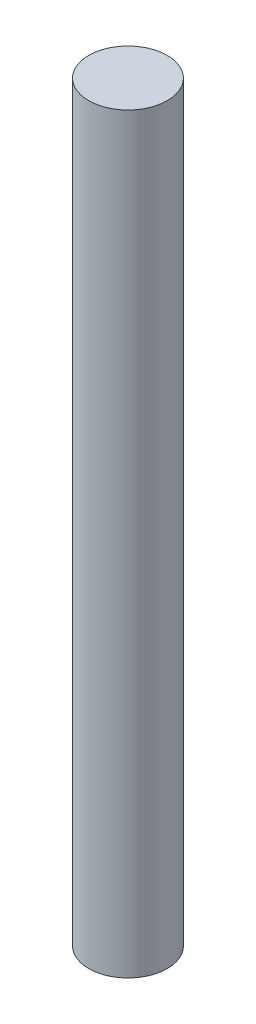
from build123d import *

# Parameters (mm, degrees)
SKETCH1_R           = 2.609499656
BOSS_EXTRUDE1_DEPTH = 50


with BuildPart() as part:
    # Sketch1 → Boss-Extrude1 (new body)
    with BuildSketch(Plane(origin=(0, 0, 0), x_dir=(1, 0, 0), z_dir=(0, 1, 0))):
        Circle(SKETCH1_R)
    extrude(amount=BOSS_EXTRUDE1_DEPTH)


solid = part.part
